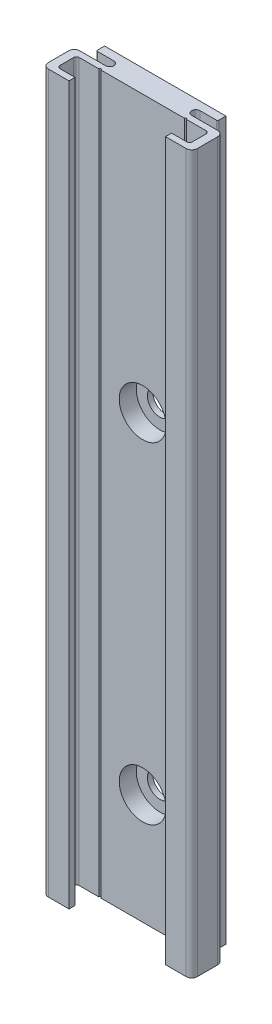
from build123d import *

# Parameters (mm, degrees)
BOSS_EXTRU_1_DEPTH                                 = 1000
ENL_V_MAT_EXTRU_1_DEPTH                            = 1001.128961684
CHAMBRAGE_POUR_VIS_T_TE_HEXAGONALE_M41_D           = 4.5
CHAMBRAGE_POUR_VIS_T_TE_HEXAGONALE_M41_CBORE_D     = 8.5
CHAMBRAGE_POUR_VIS_T_TE_HEXAGONALE_M41_CBORE_DEPTH = 3.1
DIAM_TRE_DU_PER_AGE_0_4_0_4_1_D                    = 0.4
CONG_1_R                                           = 0.2
CONG_2_R                                           = 0.5
CONG_3_R                                           = 1
ENL_V_MAT_EXTRU_2_DEPTH                            = 1001.128961684
ENL_V_MAT_EXTRU_2_DEPTH_BACK                       = 1001.128961684
ESQUISSE9_W                                        = 27
ESQUISSE9_H                                        = 870


with BuildPart() as part:
    # Esquisse1 → Boss.-Extru.1 (new body)
    with BuildSketch(Plane.XZ):
        with BuildLine():
            Line((13.5, 8.7), (-13.5, 8.7))
            Line((-13.5, 8.7), (-13.5, 3))
            Line((-13.5, 3), (-7.8, 3))
            ThreePointArc((-7.8, 3), (-7.05, 2.25), (-7.8, 1.5))
            Line((-7.8, 1.5), (-11, 1.5))
            Line((-11, 1.5), (-11, 0))
            Line((-11, 0), (11, 0))
            Line((11, 0), (11, 1.5))
            Line((11, 1.5), (7.8, 1.5))
            ThreePointArc((7.8, 1.5), (7.05, 2.25), (7.8, 3))
            Line((7.8, 3), (13.5, 3))
            Line((13.5, 3), (13.5, 8.7))
        make_face()
    extrude(amount=-BOSS_EXTRU_1_DEPTH)

    # Esquisse2 → Enlèv. mat.-Extru.1 (cut, through all)
    with BuildSketch(Plane(origin=(0, 1000, 0), x_dir=(-1, 0, 0), z_dir=(0, 1, 0))):
        Polygon((8.75, 8.7), (-8.75, 8.7), (-8.75, 7.6), (-12, 7.6), (-12, 4.1), (12, 4.1), (12, 7.6), (8.75, 7.6), align=None)
    extrude(amount=-ENL_V_MAT_EXTRU_1_DEPTH, mode=Mode.SUBTRACT)

    # Chambrage pour vis à tête hexagonale M41 (through all)
    with Locations(Plane.XY.offset(4.1)):
        with Locations((0, 980), (0, 920), (0, 860), (0, 800), (0, 740), (0, 680), (0, 620), (0, 560), (0, 500), (0, 440), (0, 380), (0, 320), (0, 260), (0, 200), (0, 140), (0, 80), (0, 20)):
            CounterBoreHole(CHAMBRAGE_POUR_VIS_T_TE_HEXAGONALE_M41_D / 2, CHAMBRAGE_POUR_VIS_T_TE_HEXAGONALE_M41_CBORE_D / 2, CHAMBRAGE_POUR_VIS_T_TE_HEXAGONALE_M41_CBORE_DEPTH)

    # Diamètre du perçage Ø0.4 (0.4)1 (through all)
    with Locations(Plane(origin=(0, 0, 0), x_dir=(-1, 0, 0), z_dir=(0, -1, 0))):
        with Locations((7.75, -4.1), (-7.75, -4.1)):
            Hole(DIAM_TRE_DU_PER_AGE_0_4_0_4_1_D / 2)

    # Congé1
    cong_1_edges = [part.edges().sort_by_distance(p)[0] for p in [
        (11, 500, 1.5),
        (-11, 500, 1.5),
    ]]
    fillet(cong_1_edges, radius=CONG_1_R)

    # Congé2
    cong_2_edges = [part.edges().sort_by_distance(p)[0] for p in [
        (12, 500, 7.6),
        (12, 500, 4.1),
        (-12, 500, 7.6),
        (-12, 500, 4.1),
    ]]
    fillet(cong_2_edges, radius=CONG_2_R)

    # Congé3
    cong_3_edges = [part.edges().sort_by_distance(p)[0] for p in [
        (13.5, 500, 3),
        (13.5, 500, 8.7),
        (-13.5, 500, 3),
        (-13.5, 500, 8.7),
    ]]
    fillet(cong_3_edges, radius=CONG_3_R)

    # Esquisse9 → Enlèv. mat.-Extru.2 (cut, two sides: drawn at the far end of the back side and taken through both)
    with BuildSketch(Plane.XY.offset(-ENL_V_MAT_EXTRU_2_DEPTH_BACK)):
        with Locations((0, 565)):
            Rectangle(ESQUISSE9_W, ESQUISSE9_H)
    extrude(amount=ENL_V_MAT_EXTRU_2_DEPTH + ENL_V_MAT_EXTRU_2_DEPTH_BACK, mode=Mode.SUBTRACT)


solid = part.part
